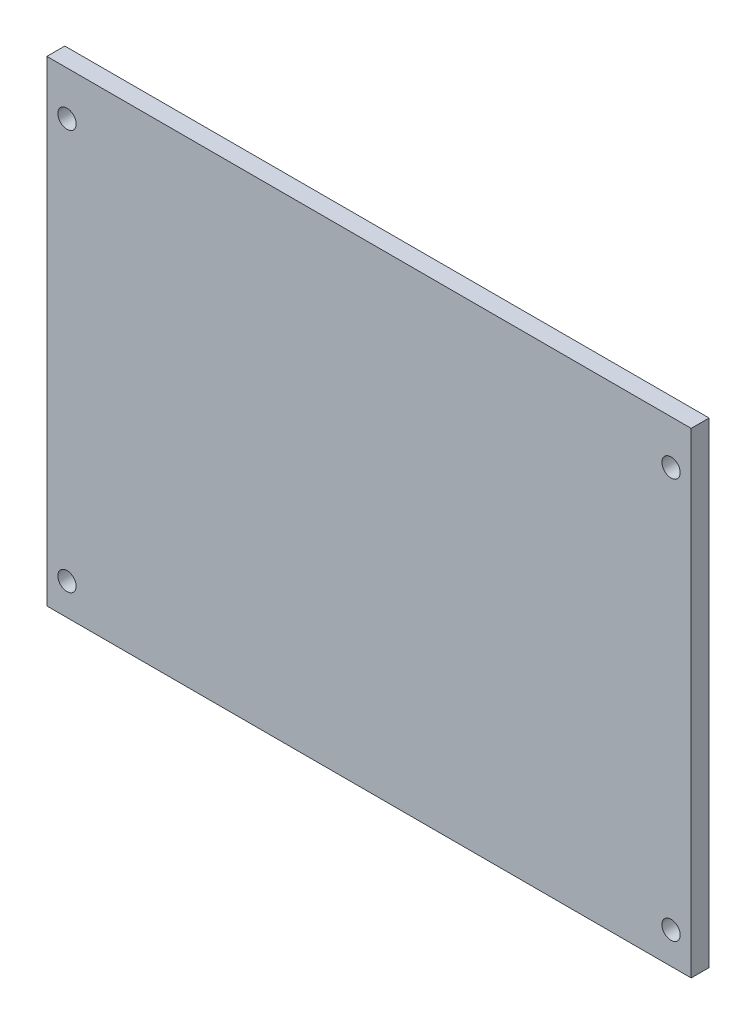
from build123d import *
from OCP.BRepFilletAPI import BRepFilletAPI_MakeChamfer

# Parameters (mm, degrees)
SKETCH1_R               = 172.5
BOSS_EXTRUDE1_DEPTH     = 10
SKETCH2_R               = 48.41
CUT_EXTRUDE1_DEPTH      = 10
BOSS_EXTRUDE2_DEPTH     = 5
CUT_EXTRUDE2_DEPTH      = 497
CUT_EXTRUDE6_START      = -497
CUT_EXTRUDE6_DEPTH      = 497
SKETCH6_W               = 195.767044214
SKETCH6_H               = 55
SKETCH6_W_2             = 185.767044214
SKETCH6_H_2             = 45
BOSS_EXTRUDE3_DEPTH     = 133.35
SKETCH7_W               = 185.767044214
SKETCH7_H               = 45
BOSS_EXTRUDE4_DEPTH     = 5
BOSS_EXTRUDE5_DEPTH     = 8
CHAMFER1_SIZE           = 8
CHAMFER1_SIZE2          = 6.250285012
CHAMFER1_PART_2_SIZE    = 8
CHAMFER1_PART_2_SIZE2   = 6.250285012
CHAMFER1_PART_3_SIZE    = 8
CHAMFER1_PART_3_SIZE2   = 6.250285012
FILLET1_R               = 38
SKETCH9_R               = 374.079334695
CUT_EXTRUDE7_DEPTH      = 93
CUT_EXTRUDE8_DEPTH      = 93
CUT_EXTRUDE8_DEPTH_BACK = 93
SKETCH10_R              = 229.38613092
SKETCH10_R_2            = 152.4
SKETCH11_W              = 291.443368419
SKETCH11_H              = 134.798764099
SKETCH11_W_2            = 144.967044214
SKETCH11_H_2            = 55
CUT_EXTRUDE9_DEPTH      = 143
SKETCH12_W              = 5
SKETCH12_H              = 55
BOSS_EXTRUDE6_DEPTH     = 133.35
SKETCH13_R              = 10
CUT_EXTRUDE10_DEPTH     = 58
SKETCH14_W              = 139.967044214
SKETCH14_H              = 45
BOSS_EXTRUDE7_DEPTH     = 5
SKETCH15_W              = 139.967044214
SKETCH15_H              = 123.35
CUT_EXTRUDE11_DEPTH     = 13
SKETCH16_W              = 10
SKETCH16_H              = 133.35
SKETCH16_W_2            = 149.967044214
BOSS_EXTRUDE9_DEPTH     = 17
SKETCH17_W              = 153.967044214
SKETCH17_H              = 115.6
SKETCH17_W_2            = 145.967044214
SKETCH17_H_2            = 107.6
CUT_EXTRUDE12_DEPTH     = 10
CHAMFER2_SIZE           = 10
CHAMFER2_SIZE2          = 5.773502692
SKETCH24_R              = 15
CUT_EXTRUDE16_DEPTH     = 177.5
SKETCH20_W              = 169.967044214
SKETCH20_H              = 3.35
CUT_EXTRUDE17_DEPTH     = 177.5
SKETCH25_W              = 139.967044214
SKETCH25_H              = 38.773502692
BOSS_EXTRUDE11_DEPTH    = 5
SKETCH26_W              = 3
SKETCH26_H              = 130
BOSS_EXTRUDE12_DEPTH    = 17
SKETCH18_R              = 2.5
CUT_EXTRUDE19_DEPTH     = 26
SKETCH27_W              = 152.567044214
SKETCH27_H              = 114.2
SKETCH27_W_2            = 147.367044214
SKETCH27_H_2            = 109
BOSS_EXTRUDE13_DEPTH    = 8.45
SKETCH27_W_3            = 138.567044214
SKETCH27_H_3            = 100.2
BOSS_EXTRUDE13_2_DEPTH  = 8.45
BOSS_EXTRUDE14_START    = 5
SKETCH28_W              = 175.967044214
SKETCH28_H              = 130
SKETCH28_R              = 2.5
BOSS_EXTRUDE14_DEPTH    = 5
SKETCH29_W              = 292.528596907
SKETCH29_H              = 171.315367969
CUT_EXTRUDE20_DEPTH     = 46.55
SKETCH30_W              = 175.967044214
SKETCH30_H              = 130
SKETCH30_W_2            = 153.967044214
SKETCH30_H_2            = 115.6
SKETCH30_W_3            = 145.967044214
SKETCH30_H_3            = 107.6
SKETCH30_W_4            = 138.567044214
SKETCH30_H_4            = 100.2
CUT_EXTRUDE23_DEPTH     = 8.55


with BuildPart() as part:
    # Sketch1 → Boss-Extrude1 (new body)
    with BuildSketch(Plane(origin=(0, 0, 0), x_dir=(1, 0, 0), z_dir=(0, 1, 0))):
        with Locations(Location((0, 0, 0), (0, 0, 270))):
            Circle(SKETCH1_R)
    extrude(amount=BOSS_EXTRUDE1_DEPTH)

    # Sketch2 → Cut-Extrude1 (cut)
    with BuildSketch(Plane(origin=(0, 10, 0), x_dir=(1, 0, 0), z_dir=(0, 1, 0))):
        with Locations((-75.91, -178.72)):
            Circle(SKETCH2_R)
        with Locations((75.91, -178.72)):
            Circle(SKETCH2_R)
    extrude(amount=-CUT_EXTRUDE1_DEPTH, mode=Mode.SUBTRACT)

    # Sketch3 → Boss-Extrude2 (add)
    with BuildSketch(Plane(origin=(0, 10, 0), x_dir=(1, 0, 0), z_dir=(0, 1, 0))):
        with BuildLine():
            Line((-98.968297449, -119.81), (98.968297449, -119.81))
            ThreePointArc((98.968297449, -119.81), (0, 155.4), (-98.968297449, -119.81))
        make_face()
        with BuildLine():
            ThreePointArc((97.883522107, -116.81), (0, 152.4), (-97.883522107, -116.81))
            Line((-97.883522107, -116.81), (97.883522107, -116.81))
        make_face(mode=Mode.SUBTRACT)
    extrude(amount=BOSS_EXTRUDE2_DEPTH)

    # Sketch4 → Cut-Extrude2 (cut)
    with BuildSketch(Plane(origin=(0, 10, 0), x_dir=(1, 0, 0), z_dir=(0, 1, 0))):
        Polygon((-28.261160255, -170.169200565), (28.261160255, -170.169200565), (28.261160255, -183.836149753), (-30.300470404, -183.836149753), align=None)
    extrude(amount=-CUT_EXTRUDE2_DEPTH, mode=Mode.SUBTRACT)

    # Sketch5 → Cut-Extrude6 (cut)
    with BuildSketch(Plane(origin=(0, 10, 0), x_dir=(1, 0, 0), z_dir=(0, 1, 0)).offset(CUT_EXTRUDE6_START)):
        with BuildLine():
            ThreePointArc((26.702080818, 170.420799435), (0, 172.5), (-26.702080818, 170.420799435))
            Line((-26.702080818, 170.420799435), (26.702080818, 170.420799435))
        make_face()
        with BuildLine():
            ThreePointArc((166.525, -45.007492432), (172.5, 0), (166.525, 45.007492432))
            Line((166.525, 45.007492432), (166.525, -45.007492432))
        make_face()
        with BuildLine():
            Line((-166.525, -45.007492432), (-166.525, 45.007492432))
            ThreePointArc((-166.525, 45.007492432), (-172.5, 0), (-166.525, -45.007492432))
        make_face()
    extrude(amount=CUT_EXTRUDE6_DEPTH, mode=Mode.SUBTRACT)

    # Sketch6 → Boss-Extrude3 (add)
    with BuildSketch(Plane(origin=(0, 10, 0), x_dir=(1, 0, 0), z_dir=(0, 1, 0))):
        with Locations((0, -89.31)):
            Rectangle(SKETCH6_W, SKETCH6_H)
        with Locations((0, -89.31)):
            Rectangle(SKETCH6_W_2, SKETCH6_H_2, mode=Mode.SUBTRACT)
    extrude(amount=BOSS_EXTRUDE3_DEPTH)

    # Sketch7 → Boss-Extrude4 (add)
    with BuildSketch(Plane(origin=(0, 10, 0), x_dir=(1, 0, 0), z_dir=(0, 1, 0))):
        with Locations((0, -89.31)):
            Rectangle(SKETCH7_W, SKETCH7_H)
    extrude(amount=BOSS_EXTRUDE4_DEPTH)

    # Sketch8 → Boss-Extrude5 (add)
    with BuildSketch(Plane(origin=(0, 10, 0), x_dir=(1, 0, 0), z_dir=(0, 1, 0))):
        with BuildLine():
            Line((-97.883522107, -61.81), (-112.883522107, -61.81))
            Line((-112.883522107, -61.81), (-112.883522107, -101.267136509))
            ThreePointArc((-112.883522107, -101.267136509), (-105.634768892, -108.807252061), (-97.883522107, -115.829782871))
            Line((-97.883522107, -115.829782871), (-97.883522107, -61.81))
        make_face()
        with BuildLine():
            Line((-88.028513968, -46.81), (-88.028513968, -61.81))
            Line((-88.028513968, -61.81), (97.883522107, -61.81))
            Line((97.883522107, -61.81), (97.883522107, -115.829782871))
            ThreePointArc((97.883522107, -115.829782871), (105.634768892, -108.807252061), (112.883522107, -101.267136509))
            Line((112.883522107, -101.267136509), (112.883522107, -46.81))
            Line((112.883522107, -46.81), (-88.028513968, -46.81))
        make_face()
    extrude(amount=BOSS_EXTRUDE5_DEPTH)

    # Chamfer1
    chamfer1_edges = [part.edges().sort_by_distance(p)[0] for p in [
        (-97.883522107, 18, 88.819891436),
    ]]
    chamfer1_side = [part.faces().sort_by_distance(p)[0] for p in [
        (-97.883522107, 80.599247918, 89.340686997),
    ]]
    chamfer(chamfer1_edges, length=CHAMFER1_SIZE, length2=CHAMFER1_SIZE2, reference=chamfer1_side[0])

    # Chamfer1 part 2
    chamfer1_part_2_edges = [part.edges().sort_by_distance(p)[0] for p in [
        (4.927504069, 18, 61.81),
    ]]
    chamfer1_part_2_side = [part.faces().sort_by_distance(p)[0] for p in [
        (-0.807441513, 80.139082253, 61.81),
    ]]
    chamfer(chamfer1_part_2_edges, length=CHAMFER1_PART_2_SIZE, length2=CHAMFER1_PART_2_SIZE2, reference=chamfer1_part_2_side[0])

    # Chamfer1 part 3
    chamfer1_part_3_edges = [part.edges().sort_by_distance(p)[0] for p in [
        (97.883522107, 18, 88.819891436),
    ]]
    chamfer1_part_3_side = [part.faces().sort_by_distance(p)[0] for p in [
        (97.883522107, 80.599247918, 89.340686997),
    ]]
    chamfer(chamfer1_part_3_edges, length=CHAMFER1_PART_3_SIZE, length2=CHAMFER1_PART_3_SIZE2, reference=chamfer1_part_3_side[0])

    # Fillet1
    # the kernel refuses this fillet: 38 mm, written as the material it adds along each edge
    with BuildSketch(Plane(origin=(-97.883522107, 26, 148.028657271), x_dir=(-0.61566147532566, -0.7880107536067207, 0), z_dir=(0, 0, -1))) as fillet1_piece_1_section:
        with BuildLine():
            CenterArc((13.24591235, 37.873851244), FILLET1_R, 232, 33.330100487)
            Line((-10.149223713, 7.929442607), (0, 0))
            Line((0, 0), (10.152145721, 0))
        make_face()
    fillet1_piece_1 = extrude(amount=86.218657271, mode=Mode.PRIVATE)
    fillet1_piece_1 = fillet1_piece_1 & Plane(origin=(0, 26, 0), x_dir=(-0.7443687577094257, 0, 0.6677687867414337), z_dir=(0, -1, 0)) * Cylinder(151.65, 214, mode=Mode.PRIVATE)
    add(fillet1_piece_1)
    with BuildSketch(Plane(origin=(-88.028513968, 26, 61.81), x_dir=(0, 1, 0), z_dir=(1, 0, 0))) as fillet1_piece_2_section:
        with BuildLine():
            CenterArc((12.87954976, -38), FILLET1_R, 90, 33.330100487)
            Line((-8, -6.250285012), (0, 0))
            Line((0, 0), (12.87954976, 0))
        make_face()
    fillet1_piece_2 = extrude(amount=218.110910475, mode=Mode.PRIVATE)
    fillet1_piece_2 = fillet1_piece_2 - Plane(origin=(135.883522107, 38.87954976, 61.81), x_dir=(-0.8355188154722692, -0.5494618357919104, 0), z_dir=(0, 0, -1)) * Cylinder(38, 488, mode=Mode.PRIVATE)
    add(fillet1_piece_2)
    with BuildSketch(Plane(origin=(97.883522107, 26, 29.6111256), x_dir=(0.61566147532566, -0.7880107536067207, 0), z_dir=(0, 0, 1))) as fillet1_piece_3_section:
        with BuildLine():
            CenterArc((13.24591235, 37.873851244), FILLET1_R, 232, 33.330100487)
            Line((-10.149223713, 7.929442607), (0, 0))
            Line((0, 0), (10.152145721, 0))
        make_face()
    fillet1_piece_3 = extrude(amount=118.417531672, mode=Mode.PRIVATE)
    fillet1_piece_3 = fillet1_piece_3 & Plane(origin=(0, 26, 0), x_dir=(0.6454567893612635, 0, 0.7637967878090673), z_dir=(0, -1, 0)) * Cylinder(151.65, 278, mode=Mode.PRIVATE)
    fillet1_piece_3 = fillet1_piece_3 - Plane(origin=(97.883522107, 38.87954976, 23.81), x_dir=(0, 0, 1), z_dir=(-1, 0, 0)) * Cylinder(38, 278, mode=Mode.PRIVATE)
    add(fillet1_piece_3)

    # Sketch9 → Cut-Extrude7 (cut)
    with BuildSketch(Plane(origin=(0, 10, 0), x_dir=(1, 0, 0), z_dir=(0, 1, 0))):
        Circle(SKETCH9_R)
    extrude(amount=-CUT_EXTRUDE7_DEPTH, mode=Mode.SUBTRACT)

    # Sketch10 → Cut-Extrude8 (cut, two sides: drawn at the far end of the back side and taken through both)
    with BuildSketch(Plane.XZ.offset(-10).offset(-CUT_EXTRUDE8_DEPTH_BACK)):
        Circle(SKETCH10_R)
        Circle(SKETCH10_R_2, mode=Mode.SUBTRACT)
    extrude(amount=CUT_EXTRUDE8_DEPTH + CUT_EXTRUDE8_DEPTH_BACK, mode=Mode.SUBTRACT)

    # Sketch11 → Cut-Extrude9 (cut)
    with BuildSketch(Plane(origin=(0, 143.35, 0), x_dir=(1, 0, 0), z_dir=(0, 1, 0))):
        with Locations((4.840839595, -88.771460056)):
            Rectangle(SKETCH11_W, SKETCH11_H)
        with Locations((-25.4, -89.31)):
            Rectangle(SKETCH11_W_2, SKETCH11_H_2, mode=Mode.SUBTRACT)
    extrude(amount=-CUT_EXTRUDE9_DEPTH, mode=Mode.SUBTRACT)

    # Sketch12 → Boss-Extrude6 (add)
    with BuildSketch(Plane(origin=(0, 143.35, 0), x_dir=(1, 0, 0), z_dir=(0, 1, 0))):
        with Locations((49.583522107, -89.31)):
            Rectangle(SKETCH12_W, SKETCH12_H)
    extrude(amount=-BOSS_EXTRUDE6_DEPTH)

    # Sketch13 → Cut-Extrude10 (cut)
    with BuildSketch(Plane.ZY.offset(97.883522107)):
        with Locations((89.418847681, 75)):
            Circle(SKETCH13_R)
    extrude(amount=-CUT_EXTRUDE10_DEPTH, mode=Mode.SUBTRACT)

    # Sketch14 → Boss-Extrude7 (add)
    with BuildSketch(Plane(origin=(0, 143.35, 0), x_dir=(1, 0, 0), z_dir=(0, 1, 0))):
        with Locations((-22.9, -89.31)):
            Rectangle(SKETCH14_W, SKETCH14_H)
    extrude(amount=-BOSS_EXTRUDE7_DEPTH)

    # Sketch15 → Cut-Extrude11 (cut)
    with BuildSketch(Plane.XY.offset(116.81)):
        with Locations((-22.9, 76.675)):
            Rectangle(SKETCH15_W, SKETCH15_H)
    extrude(amount=-CUT_EXTRUDE11_DEPTH, mode=Mode.SUBTRACT)

    # Sketch16 → Boss-Extrude9 (add)
    # profile 1 of 5: a face of its own
    with BuildSketch(Plane.XY.offset(116.81)):
        with Locations((-102.883522107, 76.675)):
            Rectangle(SKETCH16_W, SKETCH16_H)
    # profile 2 of 5: a face of its own
    with BuildSketch(Plane.XY.offset(116.81)):
        with Locations((-22.9, 76.675)):
            Rectangle(SKETCH16_W_2, SKETCH16_H)
        Polygon((-92.883522107, 127.475), (-92.883522107, 138.35), (47.083522107, 138.35), (47.083522107, 127.475), (47.083522107, 76.675), (47.083522107, 25.875), (47.083522107, 15), (-92.883522107, 15), (-92.883522107, 25.875), (-92.883522107, 76.675), align=None, mode=Mode.SUBTRACT)
    # profile 3 of 5: a face of its own
    with BuildSketch(Plane.XY.offset(116.81)):
        with Locations((57.083522107, 76.675)):
            Rectangle(SKETCH16_W, SKETCH16_H)
    # profile 4 of 5: a face of its own
    with BuildSketch(Plane.XY.offset(116.81)):
        Polygon((47.083522107, 138.35), (-92.883522107, 138.35), (-92.883522107, 127.475), (-22.9, 127.475), (47.083522107, 127.475), align=None)
    # profile 5 of 5: a face of its own
    with BuildSketch(Plane.XY.offset(116.81)):
        Polygon((-22.9, 25.875), (-92.883522107, 25.875), (-92.883522107, 15), (47.083522107, 15), (47.083522107, 25.875), align=None)
    extrude(amount=-BOSS_EXTRUDE9_DEPTH)

    # Sketch17 → Cut-Extrude12 (cut)
    with BuildSketch(Plane.XY.offset(116.81)):
        with Locations((-22.9, 76.675)):
            Rectangle(SKETCH17_W, SKETCH17_H)
        with Locations((-22.9, 76.675)):
            Rectangle(SKETCH17_W_2, SKETCH17_H_2, mode=Mode.SUBTRACT)
    extrude(amount=-CUT_EXTRUDE12_DEPTH, mode=Mode.SUBTRACT)

    # Chamfer2: one chamfer whose edges measure the first distance from different faces: ONE call of the kernel's chamfer builder (chamfer() names one face for all edges)
    chamfer2_edges_1 = [part.edges().sort_by_distance(p)[0] for p in [
        (-22.9, 25.875, 99.81),
    ]]
    chamfer2_side_1 = [part.faces().sort_by_distance(p)[0] for p in [
        (-22.9, 25.875, 108.31),
    ]]
    chamfer2_edges_2 = [part.edges().sort_by_distance(p)[0] for p in [
        (-22.9, 127.475, 99.81),
    ]]
    chamfer2_side_2 = [part.faces().sort_by_distance(p)[0] for p in [
        (-22.9, 132.9125, 99.81),
    ]]
    chamfer2 = BRepFilletAPI_MakeChamfer(part.part.solid().wrapped)
    for e in chamfer2_edges_1:
        chamfer2.Add(CHAMFER2_SIZE, CHAMFER2_SIZE2, e.wrapped, chamfer2_side_1[0].wrapped)  # the first distance lies on this face
    for e in chamfer2_edges_2:
        chamfer2.Add(CHAMFER2_SIZE, CHAMFER2_SIZE2, e.wrapped, chamfer2_side_2[0].wrapped)  # the first distance lies on this face
    add(Compound.cast(chamfer2.Shape()), mode=Mode.REPLACE)

    # Sketch24 → Cut-Extrude16 (cut)
    with BuildSketch(Plane.ZY.offset(97.883522107)):
        with Locations((83.81, 75)):
            Circle(SKETCH24_R)
    extrude(amount=-CUT_EXTRUDE16_DEPTH, mode=Mode.SUBTRACT)

    # Sketch20 → Cut-Extrude17 (cut)
    with BuildSketch(Plane.XY.offset(116.81)):
        with Locations((-22.9, 11.675)):
            Rectangle(SKETCH20_W, SKETCH20_H)
    extrude(amount=-CUT_EXTRUDE17_DEPTH, mode=Mode.SUBTRACT)

    # Sketch25 → Boss-Extrude11 (add)
    with BuildSketch(Plane(origin=(0, 13.35, 0), x_dir=(-1, 0, 0), z_dir=(0, -1, 0))):
        with Locations((22.9, -86.196751346)):
            Rectangle(SKETCH25_W, SKETCH25_H)
    extrude(amount=-BOSS_EXTRUDE11_DEPTH)

    # Sketch26 → Boss-Extrude12 (add)
    with BuildSketch(Plane.XY.offset(116.81)):
        with Locations((-109.383522107, 78.35)):
            Rectangle(SKETCH26_W, SKETCH26_H)
        with Locations((63.583522107, 78.35)):
            Rectangle(SKETCH26_W, SKETCH26_H)
    extrude(amount=-BOSS_EXTRUDE12_DEPTH)

    # Sketch18 → Cut-Extrude19 (cut)
    with BuildSketch(Plane.XY.offset(116.81)):
        with Locations((-105.383522107, 22)):
            Circle(SKETCH18_R)
        with Locations((59.583522107, 22)):
            Circle(SKETCH18_R)
        with Locations((59.583522107, 131.35)):
            Circle(SKETCH18_R)
        with Locations((-105.383522107, 131.35)):
            Circle(SKETCH18_R)
    extrude(amount=-CUT_EXTRUDE19_DEPTH, mode=Mode.SUBTRACT)



with BuildPart() as body_2:
    # Sketch27 → Boss-Extrude13 (new body)
    with BuildSketch(Plane.XY.offset(116.81)):
        with Locations((-22.9, 76.675)):
            Rectangle(SKETCH27_W, SKETCH27_H)
        with Locations((-22.9, 76.675)):
            Rectangle(SKETCH27_W_2, SKETCH27_H_2, mode=Mode.SUBTRACT)
    extrude(amount=-BOSS_EXTRUDE13_DEPTH)


with BuildPart() as body_3:
    # Sketch27 → Boss-Extrude13 2 (new body)
    with BuildSketch(Plane.XY.offset(116.81)):
        with Locations((-22.9, 76.675)):
            Rectangle(SKETCH27_W_3, SKETCH27_H_3)
    extrude(amount=-BOSS_EXTRUDE13_2_DEPTH)


with BuildPart() as part_1:
    add(part.part)

    add(body_2.part)  # Boss-Extrude14 merges body 2

    add(body_3.part)  # Boss-Extrude14 merges body 3
    # Sketch28 → Boss-Extrude14 (add)
    with BuildSketch(Plane.XY.offset(116.81).offset(BOSS_EXTRUDE14_START)):
        with Locations((-22.9, 78.35)):
            Rectangle(SKETCH28_W, SKETCH28_H)
        with Locations((-105.383522107, 131.35)):
            Circle(SKETCH28_R, mode=Mode.SUBTRACT)
        with Locations((59.583522107, 131.35)):
            Circle(SKETCH28_R, mode=Mode.SUBTRACT)
        with Locations((59.583522107, 22)):
            Circle(SKETCH28_R, mode=Mode.SUBTRACT)
        with Locations((-105.383522107, 22)):
            Circle(SKETCH28_R, mode=Mode.SUBTRACT)
    extrude(amount=-BOSS_EXTRUDE14_DEPTH)

    # Sketch29 → Cut-Extrude20 (cut)
    with BuildSketch(Plane(origin=(0, 0, 61.81), x_dir=(-1, 0, 0), z_dir=(0, 0, -1))):
        with Locations((7.671703237, 74.887303123)):
            Rectangle(SKETCH29_W, SKETCH29_H)
    extrude(amount=-CUT_EXTRUDE20_DEPTH, mode=Mode.SUBTRACT)

    # Sketch30 → Cut-Extrude23 (cut)
    # profile 1 of 2: a face of its own
    with BuildSketch(Plane(origin=(0, 0, 108.36), x_dir=(-1, 0, 0), z_dir=(0, 0, -1))):
        with Locations((22.9, 78.35)):
            Rectangle(SKETCH30_W, SKETCH30_H)
        with Locations((22.9, 76.675)):
            Rectangle(SKETCH30_W_2, SKETCH30_H_2, mode=Mode.SUBTRACT)
    # profile 2 of 2: a face of its own
    with BuildSketch(Plane(origin=(0, 0, 108.36), x_dir=(-1, 0, 0), z_dir=(0, 0, -1))):
        with Locations((22.9, 76.675)):
            Rectangle(SKETCH30_W_3, SKETCH30_H_3)
        with Locations((22.9, 76.675)):
            Rectangle(SKETCH30_W_4, SKETCH30_H_4, mode=Mode.SUBTRACT)
    extrude(amount=-CUT_EXTRUDE23_DEPTH, mode=Mode.SUBTRACT)


solid = part_1.part
